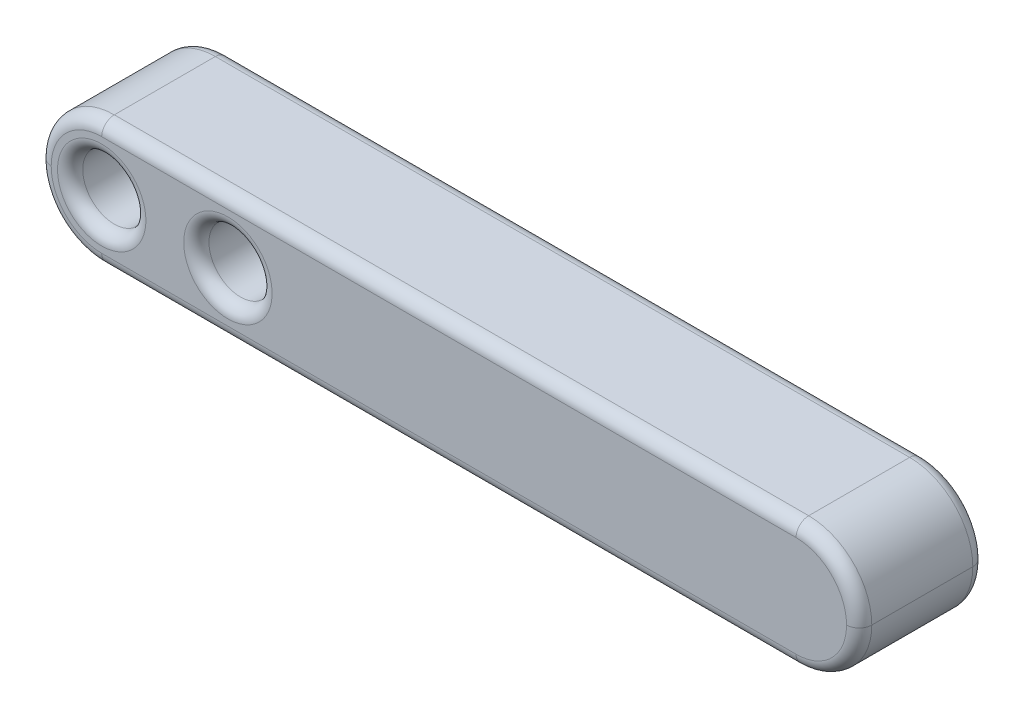
from build123d import *

# Parameters (mm, degrees)
SKETCH1_W           = 65
SKETCH1_H           = 10
SKETCH1_R           = 2.5
BOSS_EXTRUDE1_DEPTH = 10
FILLET1_R           = 5
FILLET2_R           = 1


with BuildPart() as part:
    # Sketch1 → Boss-Extrude1 (new body)
    with BuildSketch(Plane.XY):
        Rectangle(SKETCH1_W, SKETCH1_H)
        with Locations((-27.5, 0)):
            Circle(SKETCH1_R, mode=Mode.SUBTRACT)
        with Locations((-17.5, 0)):
            Circle(SKETCH1_R, mode=Mode.SUBTRACT)
    extrude(amount=BOSS_EXTRUDE1_DEPTH)

    # Fillet1
    fillet1_edges = [part.edges().sort_by_distance(p)[0] for p in [
        (32.5, -5, 5),
        (32.5, 5, 5),
        (-32.5, 5, 5),
        (-32.5, -5, 5),
    ]]
    fillet(fillet1_edges, radius=FILLET1_R - 0.0001)  # a hair under: the kernel refuses the full size

    # Fillet2
    fillet2_edges = [part.edges().sort_by_distance(p)[0] for p in [
        (-30, 0, 0),
        (-30, 0, 10),
        (-20, 0, 0),
        (-20, 0, 10),
        (0, -5, 0),
        (0, 5, 0),
        (-31.035563195, -3.535563195, 0),
        (-31.035563195, 3.535563195, 0),
        (31.035563195, 3.535563195, 0),
        (31.035563195, -3.535563195, 0),
        (0, -5, 10),
        (0, 5, 10),
        (-31.035563195, -3.535563195, 10),
        (-31.035563195, 3.535563195, 10),
        (31.035563195, 3.535563195, 10),
        (31.035563195, -3.535563195, 10),
    ]]
    fillet(fillet2_edges, radius=FILLET2_R)


solid = part.part
